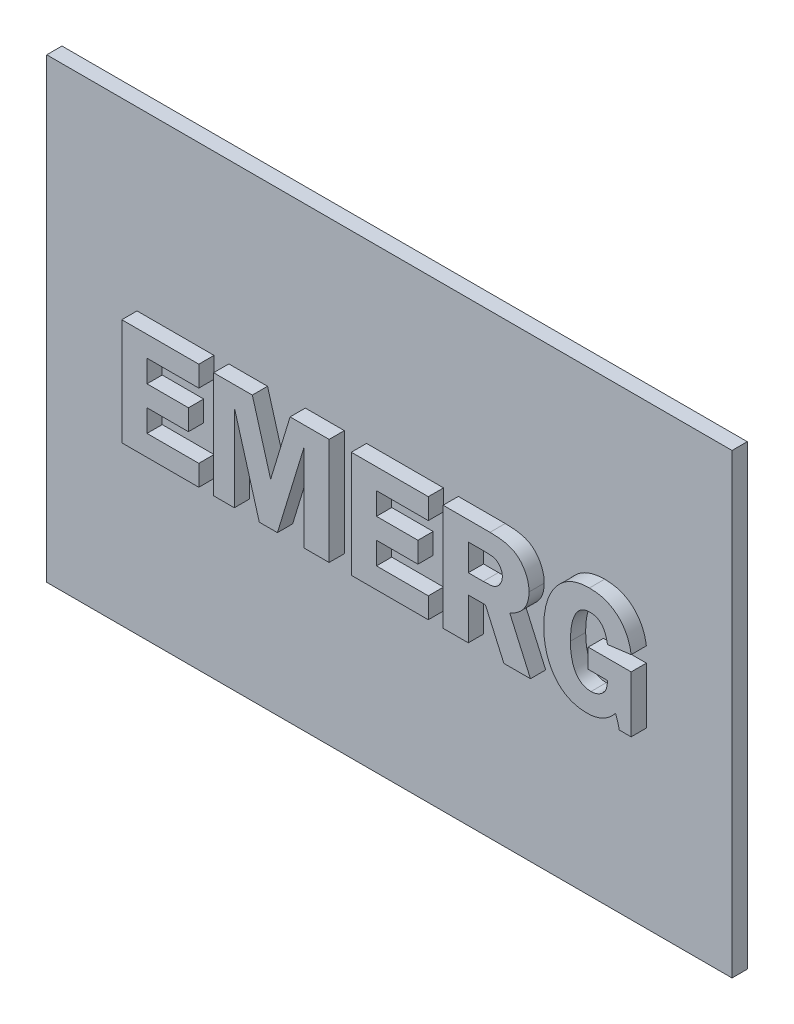
from build123d import *

# Parameters (mm, degrees)
SKETCH1_W           = 22.5
SKETCH1_H           = 15
BOSS_EXTRUDE1_DEPTH = 0.5
WRAP1_DEPTH         = 0.5


# Read off the part's stored shape, not the designer's step: Wrap1
with BuildPart() as part:
    # Sketch1 → Boss-Extrude1 (new body)
    with BuildSketch(Plane.XY):
        Rectangle(SKETCH1_W, SKETCH1_H)
    extrude(amount=BOSS_EXTRUDE1_DEPTH)

    # Wrap1 outline → Wrap1 (add)
    # profile 1 of 5: a face of its own
    with BuildSketch(Plane.XY.offset(0.5)):
        with BuildLine():
            add(Edge.make_bspline(
                [(3.803493924, 1.7), (3.838186577, 1.699737624), (3.905577867, 1.699227952), (4.004106658, 1.694439313), (4.097436101, 1.687405828), (4.185473753, 1.675438407), (4.268582918, 1.662556461), (4.345925135, 1.644514095), (4.418528998, 1.625415106), (4.48593204, 1.601446667), (4.549882754, 1.574029506), (4.610698832, 1.541360709), (4.668615985, 1.503199409), (4.723572938, 1.459789977), (4.775015799, 1.410668029), (4.825119453, 1.357598718), (4.870769885, 1.297870992), (4.91509316, 1.234825715), (4.953837747, 1.167323429), (4.989268636, 1.098512471), (5.018226078, 1.027265537), (5.041545204, 0.954026261), (5.061040943, 0.879102123), (5.073252799, 0.801997741), (5.082513812, 0.723444588), (5.083058034, 0.670334259), (5.083333333, 0.643467882)],
                knots=[0, 0, 0, 0, 0.055070055, 0.106974868, 0.156575175, 0.203587052, 0.247990588, 0.290016616, 0.329604011, 0.367104165, 0.403467023, 0.439971768, 0.476536207, 0.513445839, 0.550978289, 0.589372443, 0.629171471, 0.670199677, 0.711629506, 0.752612406, 0.792991708, 0.833538692, 0.874578709, 0.915744495, 0.957378533, 1, 1, 1, 1], degree=3))
            Line((3.803493924, 1.7), (2.263888889, 1.7))
            Line((2.263888889, 1.7), (2.263888889, -1.8))
            Line((2.263888889, -1.8), (3.090277778, -1.8))
            Line((3.090277778, -1.8), (3.090277778, -0.438888889))
            Line((3.090277778, -0.438888889), (3.653862847, -0.438888889))
            Line((3.653862847, -0.438888889), (4.25922309, -1.8))
            Line((4.25922309, -1.8), (5.131944444, -1.8))
            Line((5.131944444, -1.8), (4.451388889, -0.26875))
            add(Edge.make_bspline(
                [(5.083333333, 0.643467882), (5.082987097, 0.61736773), (5.082306518, 0.566064057), (5.074232747, 0.490740453), (5.062424991, 0.418040965), (5.044713843, 0.348327466), (5.023001904, 0.281053419), (4.995116443, 0.217095579), (4.963566305, 0.155255918), (4.925983763, 0.096870077), (4.884238863, 0.040904124), (4.836594067, -0.011318004), (4.785111855, -0.061914326), (4.72764951, -0.108654617), (4.666182879, -0.1539134), (4.59915794, -0.195320707), (4.527575007, -0.234535525), (4.477127463, -0.257191046), (4.451388889, -0.26875)],
                knots=[0, 0, 0, 0, 0.066103035, 0.1299352, 0.191736474, 0.252571309, 0.312010131, 0.370636809, 0.429168647, 0.48771806, 0.546351756, 0.605859774, 0.666650623, 0.729074695, 0.79335977, 0.859931176, 0.928536228, 1, 1, 1, 1], degree=3))
        make_face()
        with BuildLine():
            add(Edge.make_bspline(
                [(3.580186632, 0.193055556), (3.617662684, 0.193514903), (3.687101701, 0.194366023), (3.783036305, 0.199817678), (3.862241225, 0.210235689), (3.928036341, 0.224092425), (3.984199524, 0.246974179), (4.03438215, 0.280924115), (4.081415869, 0.324707146), (4.125005873, 0.377261079), (4.161986349, 0.437088991), (4.188947784, 0.502709384), (4.205458434, 0.572776145), (4.207362183, 0.621096897), (4.208333333, 0.645746528)],
                knots=[0, 0, 0, 0, 0.126672439, 0.23471015, 0.324507665, 0.396535629, 0.461372939, 0.528064151, 0.600132769, 0.677923234, 0.75820136, 0.836862379, 0.916779395, 1, 1, 1, 1], degree=3))
            Line((3.580186632, 0.193055556), (3.090277778, 0.193055556))
            Line((3.090277778, 0.193055556), (3.090277778, 1.068055556))
            Line((3.090277778, 1.068055556), (3.562717014, 1.068055556))
            add(Edge.make_bspline(
                [(4.208333333, 0.645746528), (4.207344147, 0.669131306), (4.205395444, 0.715199486), (4.18895726, 0.782041323), (4.161748546, 0.844770807), (4.124992921, 0.901994039), (4.082137755, 0.952092609), (4.037215406, 0.993961247), (3.988719093, 1.023566514), (3.935585531, 1.0442724), (3.870116386, 1.054481479), (3.787230522, 1.062502586), (3.682271793, 1.06759908), (3.605002109, 1.067894106), (3.562717014, 1.068055556)],
                knots=[0, 0, 0, 0, 0.078963896, 0.155559441, 0.231076393, 0.309186953, 0.384470768, 0.453554818, 0.515789571, 0.575391199, 0.645050674, 0.73880991, 0.857066224, 1, 1, 1, 1], degree=3))
        make_face(mode=Mode.SUBTRACT)
    # profile 2 of 5: a face of its own
    with BuildSketch(Plane.XY.offset(0.5)):
        with BuildLine():
            add(Edge.make_bspline(
                [(8.048611111, -1.8), (8.03265698, -1.731019264), (8.000090433, -1.59021157), (7.951744779, -1.454006194), (7.927083333, -1.38452691)],
                knots=[0, 0, 0, 0, 0.489893232, 1, 1, 1, 1], degree=3))
            Line((8.048611111, -1.8), (8.4375, -1.8))
            Line((8.4375, -1.8), (8.4375, 0.047222222))
            Line((8.4375, 0.047222222), (7.027777778, 0.047222222))
            Line((7.027777778, 0.047222222), (7.027777778, -0.584722222))
            Line((7.027777778, -0.584722222), (7.659722222, -0.584722222))
            add(Edge.make_bspline(
                [(7.120442708, -1.168055556), (7.15456269, -1.166641415), (7.222113367, -1.163841703), (7.319967173, -1.135479706), (7.412415665, -1.091912059), (7.483078292, -1.041311507), (7.534719007, -0.992684417), (7.56838721, -0.949615289), (7.596427811, -0.901112075), (7.620222353, -0.848077449), (7.637484985, -0.789214567), (7.650003371, -0.72564884), (7.658974883, -0.65687553), (7.659467531, -0.609311898), (7.659722222, -0.584722222)],
                knots=[0, 0, 0, 0, 0.113839351, 0.225378937, 0.337862557, 0.454399889, 0.514282548, 0.574582762, 0.636443988, 0.701264893, 0.768496234, 0.841060889, 0.917830892, 1, 1, 1, 1], degree=3))
            add(Edge.make_bspline(
                [(6.444444444, -0.076584201), (6.445127868, -0.119635576), (6.44645158, -0.203021042), (6.453773535, -0.32423507), (6.467023774, -0.437450039), (6.487369944, -0.542753882), (6.510722246, -0.640850258), (6.541463979, -0.730891969), (6.576833951, -0.813189447), (6.617857561, -0.887392166), (6.664327065, -0.953045942), (6.715448118, -1.010472833), (6.771100242, -1.059907744), (6.832236594, -1.099399842), (6.897891004, -1.130329733), (6.967883097, -1.152255059), (7.04272779, -1.165456245), (7.094056952, -1.167173038), (7.120442708, -1.168055556)],
                knots=[0, 0, 0, 0, 0.089605155, 0.173554681, 0.252640076, 0.326637626, 0.396673525, 0.462328207, 0.524393538, 0.582893738, 0.638453156, 0.691446992, 0.742603933, 0.792882167, 0.842383995, 0.893214225, 0.945106771, 1, 1, 1, 1], degree=3))
            add(Edge.make_bspline(
                [(7.086263021, 1.068055556), (7.060631393, 1.067210899), (7.010505049, 1.065559051), (6.937522586, 1.051696413), (6.869465023, 1.028085171), (6.806369964, 0.994871993), (6.748147363, 0.952846932), (6.695399805, 0.901059239), (6.647152441, 0.840386196), (6.604211807, 0.770352319), (6.566381118, 0.691866233), (6.533844329, 0.605321415), (6.505830052, 0.511186428), (6.483089601, 0.408895639), (6.466109887, 0.298727159), (6.453079697, 0.180656658), (6.445516121, 0.054664626), (6.444808372, -0.03201382), (6.444444444, -0.076584201)],
                knots=[0, 0, 0, 0, 0.052392573, 0.102461232, 0.15126336, 0.199209074, 0.247788165, 0.29759102, 0.349914456, 0.405956949, 0.465245134, 0.527852777, 0.594860669, 0.665966982, 0.741990387, 0.822734633, 0.908849485, 1, 1, 1, 1], degree=3))
            add(Edge.make_bspline(
                [(7.659722222, 0.436111111), (7.655709311, 0.461736316), (7.647922627, 0.511459652), (7.631748294, 0.583185082), (7.613053256, 0.649991098), (7.590878249, 0.711876638), (7.566094223, 0.768921126), (7.537730217, 0.820915366), (7.506847032, 0.868236988), (7.472228389, 0.910237935), (7.435144786, 0.948097333), (7.393702302, 0.97958563), (7.350366331, 1.00755935), (7.303266836, 1.02959383), (7.25341683, 1.047089034), (7.200137485, 1.059092439), (7.144227707, 1.066996713), (7.105786067, 1.067698927), (7.086263021, 1.068055556)],
                knots=[0, 0, 0, 0, 0.082191489, 0.159484973, 0.232898467, 0.301940512, 0.367695662, 0.429819924, 0.48946921, 0.54649677, 0.602106423, 0.65700512, 0.711106214, 0.765308393, 0.821396578, 0.878237506, 0.938161464, 1, 1, 1, 1], degree=3))
            Line((7.659722222, 0.436111111), (8.4375, 0.537890625))
            add(Edge.make_bspline(
                [(7.067274306, 1.748611111), (7.114407905, 1.747570689), (7.20664794, 1.745534592), (7.341589998, 1.730174961), (7.469582986, 1.704764538), (7.590412648, 1.667729236), (7.704781081, 1.621890079), (7.811525969, 1.564492815), (7.911292364, 1.497041103), (8.003498851, 1.419502923), (8.088778563, 1.333869175), (8.164689963, 1.240180481), (8.231787003, 1.13974161), (8.291642578, 1.033221224), (8.341445201, 0.919073074), (8.382560573, 0.798088035), (8.415380803, 0.670596043), (8.430051012, 0.582581264), (8.4375, 0.537890625)],
                knots=[0, 0, 0, 0, 0.070069074, 0.137124556, 0.201650146, 0.263813257, 0.324771258, 0.384560312, 0.443656803, 0.503520473, 0.563413726, 0.623088901, 0.682497508, 0.742828077, 0.80451978, 0.867376611, 0.932658764, 1, 1, 1, 1], degree=3))
            add(Edge.make_bspline(
                [(5.569444444, -0.097092014), (5.570498927, -0.029193424), (5.572557189, 0.103338977), (5.591838791, 0.296809121), (5.623631416, 0.479850097), (5.667635456, 0.652858131), (5.723497767, 0.816068001), (5.792965969, 0.968937488), (5.87521267, 1.111319656), (5.969084687, 1.243069192), (6.074605123, 1.361084804), (6.188605711, 1.46596394), (6.313677528, 1.552519732), (6.446597618, 1.624841653), (6.589019556, 1.680557916), (6.74052249, 1.71955882), (6.900838902, 1.744948697), (7.010968062, 1.747372091), (7.067274306, 1.748611111)],
                knots=[0, 0, 0, 0, 0.076094269, 0.148529686, 0.217678594, 0.284172559, 0.348435986, 0.410796815, 0.472084106, 0.532492434, 0.591791888, 0.649255708, 0.705707708, 0.761835604, 0.81854385, 0.876643326, 0.936930864, 1, 1, 1, 1], degree=3))
            add(Edge.make_bspline(
                [(6.989800347, -1.848611111), (6.935278626, -1.847238309), (6.828775346, -1.844556663), (6.673728844, -1.821117291), (6.527612692, -1.783836147), (6.391569307, -1.729005295), (6.263978284, -1.660627785), (6.146787712, -1.575256979), (6.037708654, -1.476073515), (5.940452208, -1.360905337), (5.853661443, -1.234286084), (5.77726448, -1.098351542), (5.71241765, -0.953529332), (5.660292615, -0.799278052), (5.619027328, -0.636281671), (5.590838761, -0.464234977), (5.572865886, -0.28356275), (5.570601985, -0.160178706), (5.569444444, -0.097092014)],
                knots=[0, 0, 0, 0, 0.064345405, 0.125692964, 0.184718006, 0.242009577, 0.298461161, 0.355213548, 0.412768934, 0.472141974, 0.532760404, 0.593797592, 0.656024627, 0.719840029, 0.785822383, 0.854335256, 0.925521109, 1, 1, 1, 1], degree=3))
            add(Edge.make_bspline(
                [(7.927083333, -1.38452691), (7.896239402, -1.421481302), (7.835746933, -1.493957872), (7.733050217, -1.587913316), (7.625419806, -1.668972518), (7.510593261, -1.734766305), (7.389128932, -1.785831157), (7.261469176, -1.822576666), (7.127495396, -1.844019509), (7.036209123, -1.847063556), (6.989800347, -1.848611111)],
                knots=[0, 0, 0, 0, 0.133004575, 0.260854394, 0.383963685, 0.505044677, 0.625870246, 0.747551188, 0.871658247, 1, 1, 1, 1], degree=3))
        make_face()
    # profile 3 of 5: a face of its own
    with BuildSketch(Plane.XY.offset(0.5)):
        Polygon((-7.458333333, 0.290277778), (-7.458333333, 1.019444444), (-5.756944444, 1.019444444), (-5.756944444, 1.7), (-8.284722222, 1.7), (-8.284722222, -1.8), (-5.756944444, -1.8), (-5.756944444, -1.119444444), (-7.458333333, -1.119444444), (-7.458333333, -0.390277778), (-6.097222222, -0.390277778), (-6.097222222, 0.290277778), align=None)
    # profile 4 of 5: a face of its own
    with BuildSketch(Plane.XY.offset(0.5)):
        Polygon((1.4375, 0.290277778), (0.076388889, 0.290277778), (0.076388889, 1.019444444), (1.777777778, 1.019444444), (1.777777778, 1.7), (-0.75, 1.7), (-0.75, -1.8), (1.777777778, -1.8), (1.777777778, -1.119444444), (0.076388889, -1.119444444), (0.076388889, -0.390277778), (1.4375, -0.390277778), align=None)
    # profile 5 of 5: a face of its own
    with BuildSketch(Plane.XY.offset(0.5)):
        Polygon((-5.270833333, -1.8), (-4.590277778, -1.8), (-4.590277778, 1.053624132), (-3.771484375, -1.8), (-3.175998264, -1.8), (-2.305555556, 1.053624132), (-2.305555556, -1.8), (-1.479166667, -1.8), (-1.479166667, 1.7), (-2.759765625, 1.7), (-3.399305556, -0.394835069), (-4.000108507, 1.7), (-5.270833333, 1.7), align=None)
    extrude(amount=WRAP1_DEPTH)


solid = part.part
